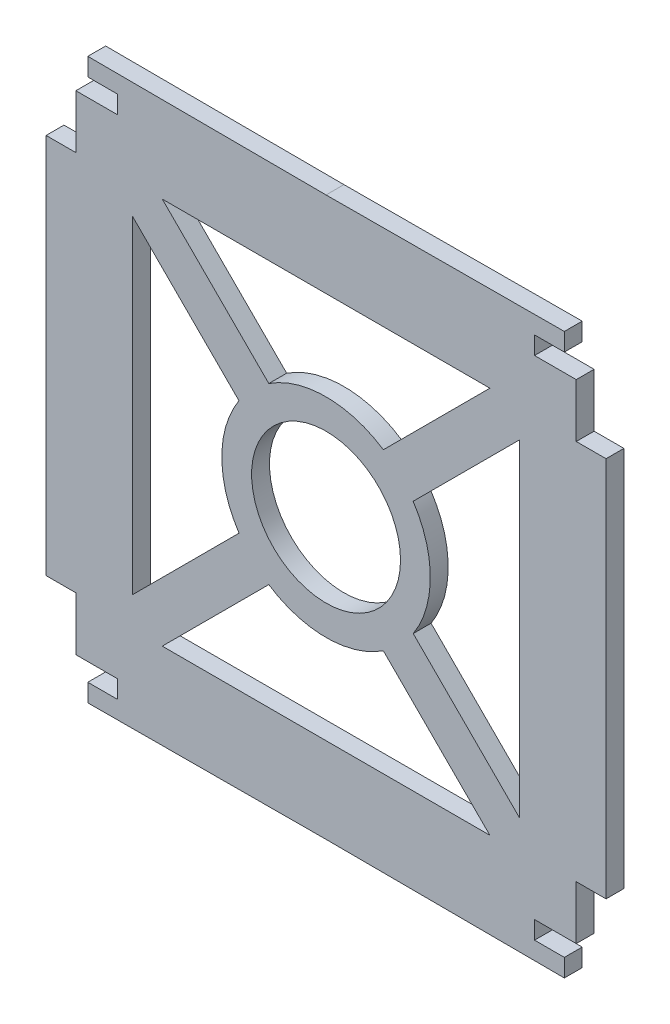
from build123d import *

# Parameters (mm, degrees)
SKETCH1_R               = 12.5
BOSS_EXTRUDE4_DEPTH     = 3
CUT_EXTRUDE_THIN3_START = -3
CUT_EXTRUDE_THIN3_DEPTH = 3


# Read off the part's stored shape, not the designer's step: Cut-Extrude-Thin3
with BuildPart() as part:
    # Sketch1 → Boss-Extrude4 (new body)
    with BuildSketch(Plane.XY):
        Polygon((-40, 47), (40, 47), (47, 47), (47, 40), (47, -40), (47, -47), (40, -47), (-40, -47), (-47, -47), (-47, -40), (-47, 40), (-47, 47), align=None)
        Circle(SKETCH1_R, mode=Mode.SUBTRACT)
        with BuildLine():
            Line((-27.5, 32.5), (27.5, 32.5))
            Line((27.5, 32.5), (9.624571705, 14.615663498))
            ThreePointArc((9.624571705, 14.615663498), (0.00658569, 17.499998761), (-9.613568497, 14.622903294))
            Line((-9.613568497, 14.622903294), (-27.5, 32.5))
        make_face(mode=Mode.SUBTRACT)
        with BuildLine():
            Line((-32.5, 27.5), (-32.5, -27.529900959))
            Line((-32.5, -27.529900959), (-14.610866481, -9.631852402))
            ThreePointArc((-14.610866481, -9.631852402), (-17.49999836, -0.007575188), (-14.619199644, 9.619199644))
            Line((-14.619199644, 9.619199644), (-32.5, 27.5))
        make_face(mode=Mode.SUBTRACT)
        with BuildLine():
            Line((-27.5, -32.5), (27.5, -32.5))
            Line((27.5, -32.5), (9.619199644, -14.619199644))
            ThreePointArc((9.619199644, -14.619199644), (0, -17.5), (-9.619199644, -14.619199644))
            Line((-9.619199644, -14.619199644), (-27.5, -32.5))
        make_face(mode=Mode.SUBTRACT)
        with BuildLine():
            Line((32.5, 27.5), (14.619199644, 9.619199644))
            ThreePointArc((14.619199644, 9.619199644), (17.4999982, 0.007937724), (14.627919862, -9.60593361))
            Line((14.627919862, -9.60593361), (32.5, -27.5))
            Line((32.5, -27.5), (32.5, 27.5))
        make_face(mode=Mode.SUBTRACT)
    extrude(amount=BOSS_EXTRUDE4_DEPTH)

    # Cut-Extrude-Thin3 outline → Cut-Extrude-Thin3 (cut)
    with BuildSketch(Plane(origin=(0, 0, 0), x_dir=(-1, 0, 0), z_dir=(0, 0, -1)).offset(CUT_EXTRUDE_THIN3_START)):
        Polygon((-42, -41), (-42, -32), (-47, -32), (-47, -47), (-39.999705668, -47), (-39.999705668, -44), (-34.999705668, -44), (-34.999705668, -41), align=None)
        Polygon((-47, 47), (-47, 32), (-42, 32), (-42, 41), (-34.999705668, 41), (-34.999705668, 44), (-39.999705668, 44), (-39.999705668, 47), align=None)
        Polygon((0, -46.846551451), (-39.999705668, -47), (39.999705668, -47), align=None)
        Polygon((39.999705668, -44), (39.999705668, -47), (47, -47), (47, -32), (42, -32), (42, -41), (34.999705668, -41), (34.999705668, -44), align=None)
        Polygon((39.999705668, 47), (-39.999705668, 47), (0, 46.846551451), align=None)
        Polygon((47, 47), (39.999705668, 47), (39.999705668, 44), (34.999705668, 44), (34.999705668, 41), (42, 41), (42, 32), (47, 32), align=None)
    extrude(amount=CUT_EXTRUDE_THIN3_DEPTH, mode=Mode.SUBTRACT)


solid = part.part
